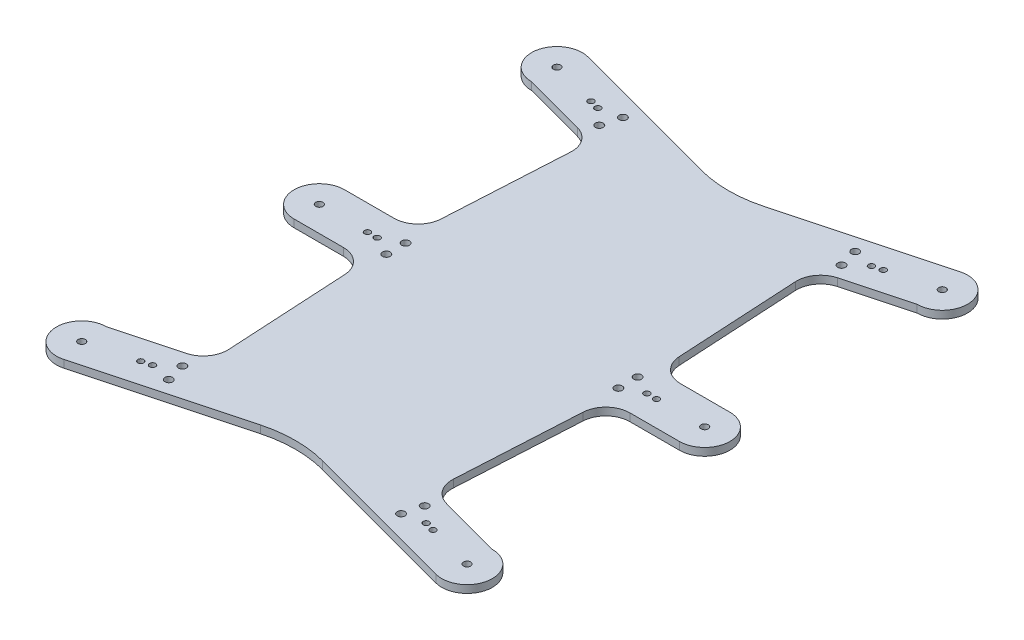
from build123d import *

# Parameters (mm, degrees)
SKETCH1_R           = 1.5
SKETCH1_R_2         = 1.6
BOSS_EXTRUDE1_DEPTH = 3.175
CUT_EXTRUDE1_DEPTH  = 142.82756039
FILLET1_R           = 50
FILLET2_R           = 10


with BuildPart() as part:
    # Sketch1 → Boss-Extrude1 (new body)
    with BuildSketch(Plane(origin=(0, 0, 0), x_dir=(1, 0, 0), z_dir=(0, 1, 0))):
        with BuildLine():
            Line((-80, 10.5), (-50, 10.5))
            Line((-50, 10.5), (-46.19259608, 79.095931406))
            Line((-46.19259608, 79.095931406), (-80, 88.154597985))
            ThreePointArc((-80, 88.154597985), (-90.410171044, 100.025123003), (-77.282400026, 108.796819161))
            Line((-77.282400026, 108.796819161), (0, 88.089062485))
            Line((0, 88.089062485), (77.282400026, 108.796819161))
            ThreePointArc((77.282400026, 108.796819161), (90.410171044, 100.025123003), (80, 88.154597985))
            Line((80, 88.154597985), (46.19259608, 79.095931406))
            Line((46.19259608, 79.095931406), (50, 10.5))
            Line((50, 10.5), (80, 10.5))
            ThreePointArc((80, 10.5), (90.5, 0), (80, -10.5))
            Line((80, -10.5), (50, -10.5))
            Line((50, -10.5), (46.19259608, -79.095931406))
            Line((46.19259608, -79.095931406), (80, -88.154597985))
            ThreePointArc((80, -88.154597985), (90.410171044, -100.025123003), (77.282400026, -108.796819161))
            Line((77.282400026, -108.796819161), (0, -88.089062485))
            Line((0, -88.089062485), (-77.282400026, -108.796819161))
            ThreePointArc((-77.282400026, -108.796819161), (-90.410171044, -100.025123003), (-80, -88.154597985))
            Line((-80, -88.154597985), (-46.19259608, -79.095931406))
            Line((-46.19259608, -79.095931406), (-50, -10.5))
            Line((-50, -10.5), (-80, -10.5))
            ThreePointArc((-80, -10.5), (-90.5, 0), (-80, 10.5))
        make_face()
        with Locations((-80, 98.654597985)):
            Circle(SKETCH1_R, mode=Mode.SUBTRACT)
        with Locations((-80, 0)):
            Circle(SKETCH1_R, mode=Mode.SUBTRACT)
        with Locations((80, 0)):
            Circle(SKETCH1_R, mode=Mode.SUBTRACT)
        with Locations((80, 98.654597985)):
            Circle(SKETCH1_R, mode=Mode.SUBTRACT)
        with Locations((80, -98.654597985)):
            Circle(SKETCH1_R, mode=Mode.SUBTRACT)
        with Locations((-80, -98.654597985)):
            Circle(SKETCH1_R, mode=Mode.SUBTRACT)
        with Locations((50.294686759, -86.553978569)):
            Circle(SKETCH1_R_2, mode=Mode.SUBTRACT)
        with Locations((48.224134398, -94.28138518)):
            Circle(SKETCH1_R_2, mode=Mode.SUBTRACT)
        with Locations((48.175, -4)):
            Circle(SKETCH1_R_2, mode=Mode.SUBTRACT)
        with Locations((48.175, 4)):
            Circle(SKETCH1_R_2, mode=Mode.SUBTRACT)
        with Locations((50.294686759, 86.553978569)):
            Circle(SKETCH1_R_2, mode=Mode.SUBTRACT)
        with Locations((48.224134398, 94.28138518)):
            Circle(SKETCH1_R_2, mode=Mode.SUBTRACT)
        with Locations((-50.294686759, 86.553978569)):
            Circle(SKETCH1_R_2, mode=Mode.SUBTRACT)
        with Locations((-48.224134398, 94.28138518)):
            Circle(SKETCH1_R_2, mode=Mode.SUBTRACT)
        with Locations((-48.175, 4)):
            Circle(SKETCH1_R_2, mode=Mode.SUBTRACT)
        with Locations((-48.175, -4)):
            Circle(SKETCH1_R_2, mode=Mode.SUBTRACT)
        with Locations((-50.294686759, -86.553978569)):
            Circle(SKETCH1_R_2, mode=Mode.SUBTRACT)
        with Locations((-48.224134398, -94.28138518)):
            Circle(SKETCH1_R_2, mode=Mode.SUBTRACT)
    extrude(amount=BOSS_EXTRUDE1_DEPTH)

    # Sketch2 → Cut-Extrude1 (cut, through all)
    with BuildSketch(Plane(origin=(0, 3.175, 0), x_dir=(1, 0, 0), z_dir=(0, 1, 0))):
        with BuildLine():
            ThreePointArc((55.610372886, -92.119417096), (56.494256363, -93.650348185), (58.025187452, -92.766464709))
            ThreePointArc((58.025187452, -92.766464709), (57.141303975, -91.23553362), (55.610372886, -92.119417096))
        make_face()
        with BuildLine():
            ThreePointArc((61.888890757, -93.801740889), (61.005007281, -92.2708098), (59.474076191, -93.154693277))
            ThreePointArc((59.474076191, -93.154693277), (60.357959668, -94.685624366), (61.888890757, -93.801740889))
        make_face()
        with BuildLine():
            ThreePointArc((54.75, 0), (56, -1.25), (57.25, 0))
            ThreePointArc((57.25, 0), (56, 1.25), (54.75, 0))
        make_face()
        with BuildLine():
            ThreePointArc((61.25, 0), (60, 1.25), (58.75, 0))
            ThreePointArc((58.75, 0), (60, -1.25), (61.25, 0))
        make_face()
        with BuildLine():
            ThreePointArc((58.025187452, 92.766464709), (56.494256363, 93.650348185), (55.610372886, 92.119417096))
            ThreePointArc((55.610372886, 92.119417096), (57.141303975, 91.23553362), (58.025187452, 92.766464709))
        make_face()
        with BuildLine():
            ThreePointArc((61.888890757, 93.801740889), (60.357959668, 94.685624366), (59.474076191, 93.154693277))
            ThreePointArc((59.474076191, 93.154693277), (61.005007281, 92.2708098), (61.888890757, 93.801740889))
        make_face()
        with BuildLine():
            ThreePointArc((-59.474076191, 93.154693277), (-60.357959668, 94.685624366), (-61.888890757, 93.801740889))
            ThreePointArc((-61.888890757, 93.801740889), (-61.005007281, 92.2708098), (-59.474076191, 93.154693277))
        make_face()
        with BuildLine():
            ThreePointArc((-58.025187452, 92.766464709), (-57.141303975, 91.23553362), (-55.610372886, 92.119417096))
            ThreePointArc((-55.610372886, 92.119417096), (-56.494256363, 93.650348185), (-58.025187452, 92.766464709))
        make_face()
        with BuildLine():
            ThreePointArc((-58.75, 0), (-60, 1.25), (-61.25, 0))
            ThreePointArc((-61.25, 0), (-60, -1.25), (-58.75, 0))
        make_face()
        with BuildLine():
            ThreePointArc((-57.25, 0), (-56, -1.25), (-54.75, 0))
            ThreePointArc((-54.75, 0), (-56, 1.25), (-57.25, 0))
        make_face()
        with BuildLine():
            ThreePointArc((-58.025187452, -92.766464709), (-56.494256363, -93.650348185), (-55.610372886, -92.119417096))
            ThreePointArc((-55.610372886, -92.119417096), (-57.141303975, -91.23553362), (-58.025187452, -92.766464709))
        make_face()
        with BuildLine():
            ThreePointArc((-59.474076191, -93.154693277), (-61.005007281, -92.2708098), (-61.888890757, -93.801740889))
            ThreePointArc((-61.888890757, -93.801740889), (-60.357959668, -94.685624366), (-59.474076191, -93.154693277))
        make_face()
    extrude(amount=-CUT_EXTRUDE1_DEPTH, mode=Mode.SUBTRACT)

    # Fillet1
    fillet1_edges = [part.edges().sort_by_distance(p)[0] for p in [
        (0, 1.5875, -88.089062485),
        (0, 1.5875, 88.089062485),
    ]]
    fillet(fillet1_edges, radius=FILLET1_R)

    # Fillet2
    fillet2_edges = [part.edges().sort_by_distance(p)[0] for p in [
        (46.19259608, 1.5875, 79.095931406),
        (50, 1.5875, 10.5),
        (50, 1.5875, -10.5),
        (46.19259608, 1.5875, -79.095931406),
        (-46.19259608, 1.5875, -79.095931406),
        (-50, 1.5875, -10.5),
        (-50, 1.5875, 10.5),
        (-46.19259608, 1.5875, 79.095931406),
    ]]
    fillet(fillet2_edges, radius=FILLET2_R)


solid = part.part
